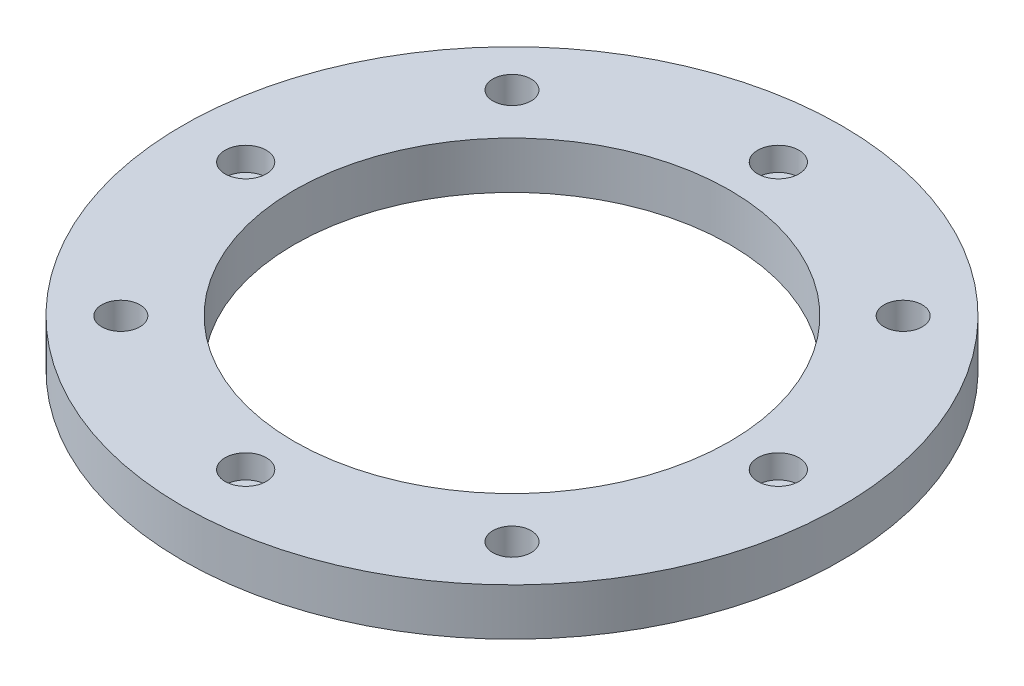
from build123d import *

# Parameters (mm, degrees)
SKETCH1_W                                        = 177.8
SKETCH1_H                                        = 177.8
BOSS_EXTRUDE1_DEPTH                              = 12.7
F_13_32_0_40625_DIAMETER_HOLE1_D                 = 10.31875
SKETCH4_R                                        = 58.7375
CUT_EXTRUDE1_DEPTH                               = 127.363404513
SKETCH5_OUTSIDE_W                                = 230.154
SKETCH5_OUTSIDE_H                                = 230.154
SKETCH5_OUTSIDE_R                                = 88.9
CUT_EXTRUDE2_DEPTH                               = 12.7
CBORE_FOR_1_4_SOCKET_HEAD_CAP_SCREW1_D           = 6.7564
CBORE_FOR_1_4_SOCKET_HEAD_CAP_SCREW1_CBORE_D     = 11.1125
CBORE_FOR_1_4_SOCKET_HEAD_CAP_SCREW1_CBORE_DEPTH = 6.35


with BuildPart() as part:
    # Sketch1 → Boss-Extrude1 (new body)
    with BuildSketch(Plane(origin=(0, 0, 0), x_dir=(1, 0, 0), z_dir=(0, 1, 0))):
        Rectangle(SKETCH1_W, SKETCH1_H)
    extrude(amount=BOSS_EXTRUDE1_DEPTH)

    # 13/32 (0.40625) Diameter Hole1 (through all)
    with Locations(Plane(origin=(-52.759004711, 12.7, -52.759004711), x_dir=(0, 0, 1), z_dir=(0, 1, 0))):
        with Locations((0, 0), (0, 105.518009422), (105.518009422, 105.518009422), (105.518009422, 0)):
            Hole(F_13_32_0_40625_DIAMETER_HOLE1_D / 2)

    # Sketch4 → Cut-Extrude1 (cut, through all)
    with BuildSketch(Plane(origin=(0, 12.7, 0), x_dir=(1, 0, 0), z_dir=(0, 1, 0))):
        Circle(SKETCH4_R)
    extrude(amount=-CUT_EXTRUDE1_DEPTH, mode=Mode.SUBTRACT)

    # Sketch5 outside → Cut-Extrude2 (cut)
    with BuildSketch(Plane(origin=(0, 12.7, 0), x_dir=(1, 0, 0), z_dir=(0, 1, 0))):
        Rectangle(SKETCH5_OUTSIDE_W, SKETCH5_OUTSIDE_H)
        Circle(SKETCH5_OUTSIDE_R, mode=Mode.SUBTRACT)
    extrude(amount=-CUT_EXTRUDE2_DEPTH, mode=Mode.SUBTRACT)

    # CBORE for 1/4 Socket Head Cap Screw1 (through all)
    with Locations(Plane(origin=(0, 12.7, -71.842048969), x_dir=(0, 0, 1), z_dir=(0, 1, 0))):
        with Locations((0, 0), (71.842048969, 71.842048969), (71.842048969, -71.842048969), (143.684097938, 0)):
            CounterBoreHole(CBORE_FOR_1_4_SOCKET_HEAD_CAP_SCREW1_D / 2, CBORE_FOR_1_4_SOCKET_HEAD_CAP_SCREW1_CBORE_D / 2, CBORE_FOR_1_4_SOCKET_HEAD_CAP_SCREW1_CBORE_DEPTH)


solid = part.part
